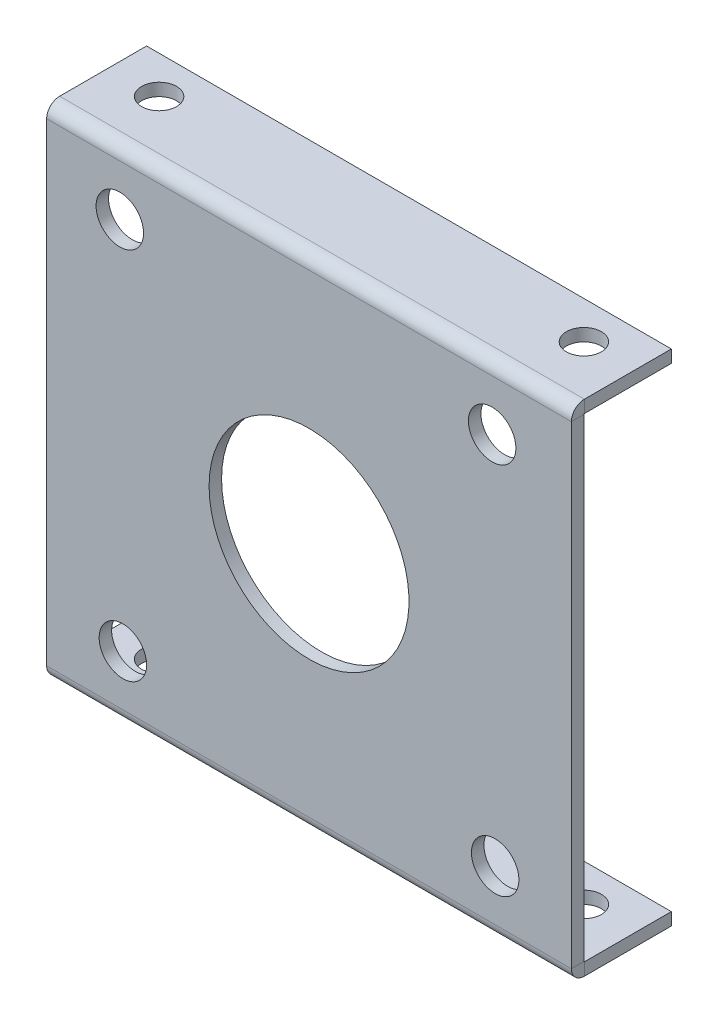
from build123d import *

# Parameters (mm, degrees)
SKETCH1_W                    = 210
SKETCH1_H                    = 200
BASE_FLANGE1_DEPTH           = 5
EDGE_FLANGE1_STRIP_W         = 20.4
EDGE_FLANGE1_STRIP_H         = 5
EDGE_FLANGE1_STRIP_CUT_DEPTH = 210
EDGE_FLANGE1_DEPTH           = 210
EDGE_FLANGE2_STRIP_W         = 20.4
EDGE_FLANGE2_STRIP_H         = 5
EDGE_FLANGE2_STRIP_CUT_DEPTH = 210
EDGE_FLANGE2_DEPTH           = 210
CUT_EXTRUDE1_DEPTH           = 151.416089565
CUT_EXTRUDE1_DEPTH_BACK      = 151.416089565
SKETCH12_R                   = 40
CUT_EXTRUDE2_DEPTH           = 151.416089565
CUT_EXTRUDE2_DEPTH_BACK      = 151.416089565
SKETCH13_R                   = 9.5
CUT_EXTRUDE3_DEPTH           = 230.401394939
CUT_EXTRUDE3_DEPTH_BACK      = 230.401394939
SKETCH14_R                   = 7


# Sheet-metal steps are written as plain solids
with BuildPart() as part:
    # Sketch1 → Base-Flange1 (new body)
    with BuildSketch(Plane.XY):
        Rectangle(SKETCH1_W, SKETCH1_H)
    extrude(amount=-BASE_FLANGE1_DEPTH)

    # Edge-Flange1 strip (across the edge) → Edge-Flange1 strip cut (cut)
    with BuildSketch(Plane(origin=(-105, 100, -5), x_dir=(0, -1, 0), z_dir=(1, 0, 0))):
        with Locations((-5, -2.5)):
            Rectangle(EDGE_FLANGE1_STRIP_W, EDGE_FLANGE1_STRIP_H)
    extrude(amount=EDGE_FLANGE1_STRIP_CUT_DEPTH, mode=Mode.SUBTRACT)

    # Edge-Flange1 section (across the edge) → Edge-Flange1 (add)
    with BuildSketch(Plane(origin=(-105, 100, -5), x_dir=(0, -1, 0), z_dir=(1, 0, 0))):
        with BuildLine():
            Line((0, 0.2), (0, 35))
            Line((0, 35), (5, 35))
            Line((5, 35), (5, 0.2))
            ThreePointArc((5, 0.2), (5.058578644, 0.058578644), (5.2, 0))
            Line((5.2, 0), (5.2, -5))
            ThreePointArc((5.2, -5), (1.523044738, -3.476955262), (0, 0.2))
        make_face()
    extrude(amount=EDGE_FLANGE1_DEPTH)

    # Edge-Flange2 strip (across the edge) → Edge-Flange2 strip cut (cut)
    with BuildSketch(Plane(origin=(105, -100, -5), x_dir=(0, 1, 0), z_dir=(-1, 0, 0))):
        with Locations((-5, -2.5)):
            Rectangle(EDGE_FLANGE2_STRIP_W, EDGE_FLANGE2_STRIP_H)
    extrude(amount=EDGE_FLANGE2_STRIP_CUT_DEPTH, mode=Mode.SUBTRACT)

    # Edge-Flange2 section (across the edge) → Edge-Flange2 (add)
    with BuildSketch(Plane(origin=(105, -100, -5), x_dir=(0, 1, 0), z_dir=(-1, 0, 0))):
        with BuildLine():
            Line((0, 0.2), (0, 35))
            Line((0, 35), (5, 35))
            Line((5, 35), (5, 0.2))
            ThreePointArc((5, 0.2), (5.058578644, 0.058578644), (5.2, 0))
            Line((5.2, 0), (5.2, -5))
            ThreePointArc((5.2, -5), (1.523044738, -3.476955262), (0, 0.2))
        make_face()
    extrude(amount=EDGE_FLANGE2_DEPTH)

    # Sketch12 → Cut-Extrude1 (cut, two sides: drawn at the far end of the back side and taken through both)
    with BuildSketch(Plane.XY.offset(-CUT_EXTRUDE1_DEPTH_BACK)):
        with Locations(Location((0, 0, 0), (0, 0, 180))):
            Circle(SKETCH12_R)
    extrude(amount=CUT_EXTRUDE1_DEPTH + CUT_EXTRUDE1_DEPTH_BACK, mode=Mode.SUBTRACT)

    # Sketch13 → Cut-Extrude2 (cut, two sides: drawn at the far end of the back side and taken through both)
    with BuildSketch(Plane.XY.offset(-CUT_EXTRUDE2_DEPTH_BACK)):
        with Locations(Location((73.282986518, 74.49502971, 0), (0, 0, 180))):
            Circle(SKETCH13_R)
        with Locations(Location((-75.717013482, 74.49502971, 0), (0, 0, 180))):
            Circle(SKETCH13_R)
        with Locations(Location((-74.5, -74.5, 0), (0, 0, 180))):
            Circle(SKETCH13_R)
        with Locations(Location((74.5, -74.5, 0), (0, 0, 180))):
            Circle(SKETCH13_R)
    extrude(amount=CUT_EXTRUDE2_DEPTH + CUT_EXTRUDE2_DEPTH_BACK, mode=Mode.SUBTRACT)

    # Sketch14 → Cut-Extrude3 (cut, two sides: drawn at the far end of the back side and taken through both)
    with BuildSketch(Plane(origin=(0, -100, 0), x_dir=(-1, 0, 0), z_dir=(0, -1, 0)).offset(-CUT_EXTRUDE3_DEPTH_BACK)):
        with Locations(Location((85, 25, 0), (0, 0, 270))):
            Circle(SKETCH14_R)
        with Locations(Location((-85, 25, 0), (0, 0, 270))):
            Circle(SKETCH14_R)
    extrude(amount=CUT_EXTRUDE3_DEPTH + CUT_EXTRUDE3_DEPTH_BACK, mode=Mode.SUBTRACT)


solid = part.part
